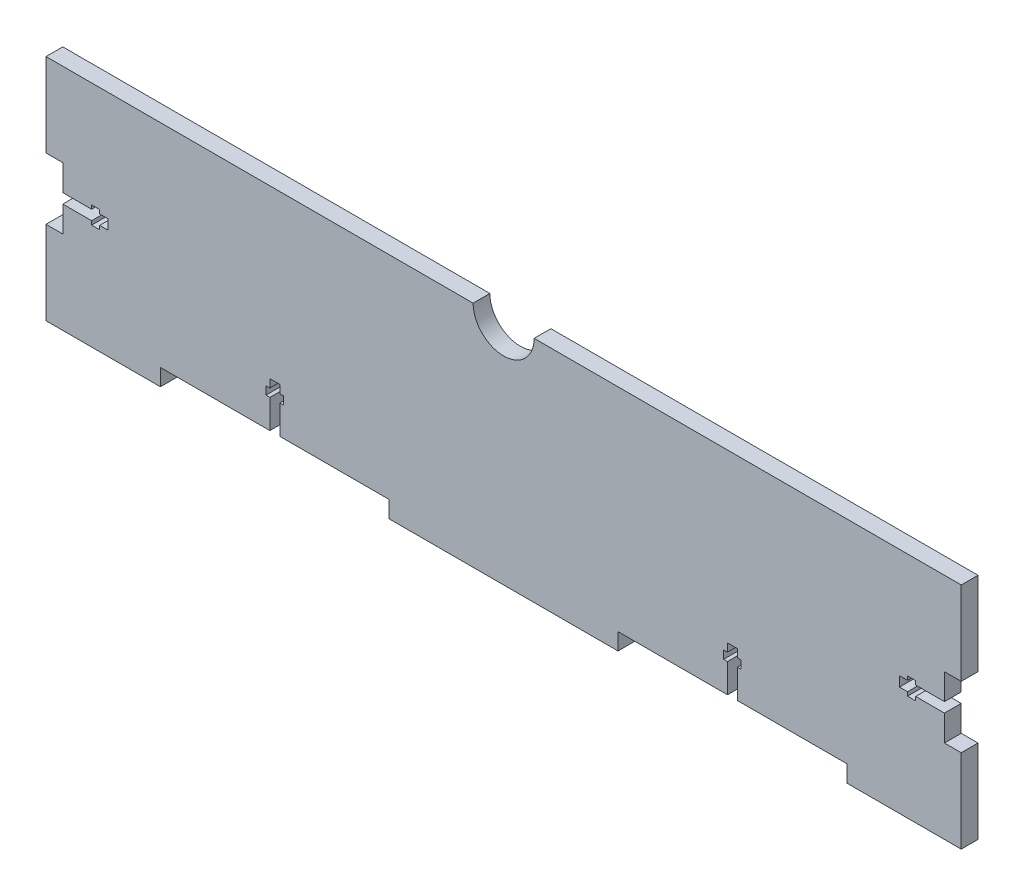
from build123d import *

# Parameters (mm, degrees)
BOSS_EXTRUDE1_DEPTH = 5.5
SKETCH2_R           = 10
CUT_EXTRUDE2_DEPTH  = 311.022983019


with BuildPart() as part:
    # Sketch1 → Boss-Extrude1 (new body)
    with BuildSketch(Plane.XY):
        Polygon((0, 78), (0, 50.625), (5.5, 50.625), (5.5, 42.125), (14.95, 42.125), (14.95, 43.375), (17.6, 43.375), (17.6, 42.125), (20.25, 42.125), (20.25, 38.875), (17.6, 38.875), (17.6, 37.625), (14.95, 37.625), (14.95, 38.875), (5.5, 38.875), (5.5, 30.375), (0, 30.375), (0, 3), (37.5, 3), (37.5, 8.5), (73.375, 8.5), (73.375, 17.95), (72.125, 17.95), (72.125, 20.6), (73.375, 20.6), (73.375, 23.25), (76.625, 23.25), (76.625, 20.6), (77.875, 20.6), (77.875, 17.95), (76.625, 17.95), (76.625, 8.5), (112.5, 8.5), (112.5, 3), (187.5, 3), (187.5, 8.5), (223.375, 8.5), (223.375, 17.95), (222.125, 17.95), (222.125, 20.6), (223.375, 20.6), (223.375, 23.25), (226.625, 23.25), (226.625, 20.6), (227.875, 20.6), (227.875, 17.95), (226.625, 17.95), (226.625, 8.5), (262.5, 8.5), (262.5, 3), (300, 3), (300, 30.375), (294.5, 30.375), (294.5, 38.875), (285.05, 38.875), (285.05, 37.625), (282.4, 37.625), (282.4, 38.875), (279.75, 38.875), (279.75, 42.125), (282.4, 42.125), (282.4, 43.375), (285.05, 43.375), (285.05, 42.125), (294.5, 42.125), (294.5, 50.625), (300, 50.625), (300, 78), align=None)
    extrude(amount=BOSS_EXTRUDE1_DEPTH)

    # Sketch2 → Cut-Extrude2 (cut, through all)
    with BuildSketch(Plane.XY):
        with Locations((150, 78)):
            Circle(SKETCH2_R)
    extrude(amount=CUT_EXTRUDE2_DEPTH, mode=Mode.SUBTRACT)


solid = part.part
